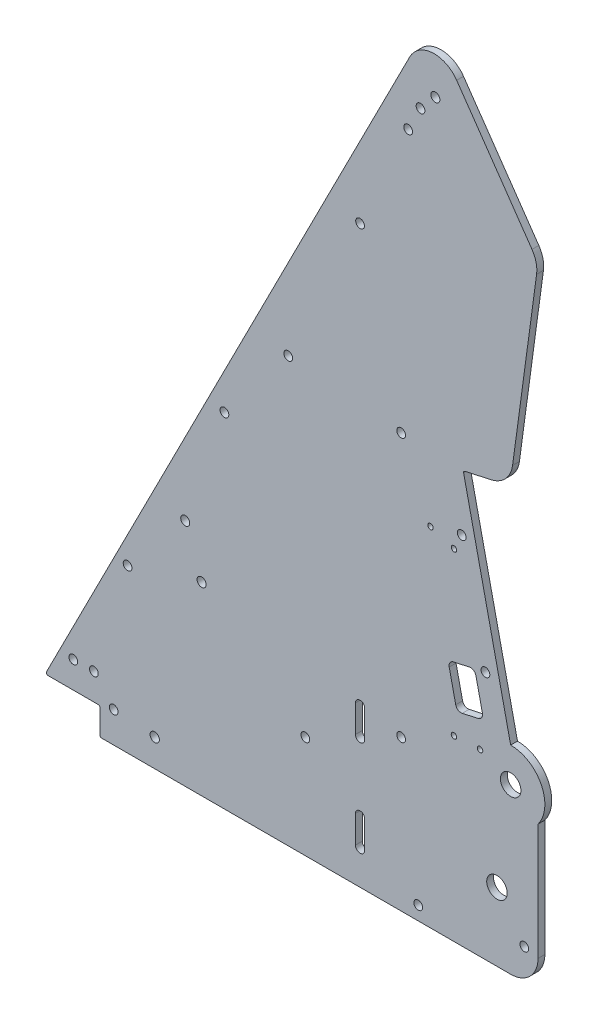
from build123d import *

# Parameters (mm, degrees)
BOSS_EXTRUDE1_DEPTH     = 3.175
SKETCH2_R               = 2.0955
SKETCH2_R_2             = 2.032
SKETCH2_R_3             = 4.7625
CUT_EXTRUDE1_DEPTH      = 421.976111717
SKETCH7_R               = 2.159
CUT_EXTRUDE2_DEPTH      = 421.976111717
CUT_EXTRUDE3_REACH      = 422.976
SKETCH10_R              = 2.032
FILLET1_R               = 12.7
FILLET2_R               = 0.79375
SKETCH12_R              = 2.032
CUT_EXTRUDE5_DEPTH      = 411.989226146
CUT_EXTRUDE6_DEPTH      = 411.989226146
CUT_EXTRUDE6_DEPTH_BACK = 411.989226146
SKETCH13_R              = 1.27
CUT_EXTRUDE7_REACH      = 412.989
SKETCH14_R              = 2.032
SKETCH15_R              = 2.032
CUT_EXTRUDE8_DEPTH      = 411.989226146
FILLET3_R               = 2.54


with BuildPart() as part:
    # Sketch1 → Boss-Extrude1 (new body)
    with BuildSketch(Plane.XY):
        with BuildLine():
            Line((228.6, -12.7), (228.6, 53.975))
            ThreePointArc((228.6, 53.975), (230.099031657, 70.599515829), (215.9, 79.375))
            Line((215.9, 79.375), (193.909735224, 178.566674323))
            Line((193.909735224, 178.566674323), (215.607913982, 183.377044743))
            Line((215.607913982, 183.377044743), (228.6, 279.4))
            Line((228.6, 279.4), (178.754725958, 351.413083686))
            Line((178.754725958, 351.413083686), (0, 0))
            Line((0, 0), (25.4, 0))
            Line((25.4, 0), (25.4, -12.7))
            Line((25.4, -12.7), (228.6, -12.7))
        make_face()
    extrude(amount=BOSS_EXTRUDE1_DEPTH)

    # Sketch2 → Cut-Extrude1 (cut, through all)
    with BuildSketch(Plane.XY.offset(3.175)):
        with Locations((64.943150167, 94.057839899)):
            Circle(SKETCH2_R)
        with Locations((180.975, 322.164313376)):
            Circle(SKETCH2_R)
        with Locations((72.544547852, 73.173171402)):
            Circle(SKETCH2_R)
        with Locations((193.207821773, 152.394364194)):
            Circle(SKETCH2_R_2)
        with Locations((215.9, 63.5)):
            Circle(SKETCH2_R_3)
        with Locations((173.0375, -6.35)):
            Circle(SKETCH2_R_2)
        with Locations((204.202954161, 102.798527032)):
            Circle(SKETCH2_R_2)
        with Locations((209.55, 19.05)):
            Circle(SKETCH2_R_3)
        with Locations((165.1, 179.3875)):
            Circle(SKETCH2_R_2)
    extrude(amount=-CUT_EXTRUDE1_DEPTH, mode=Mode.SUBTRACT)

    # Sketch7 → Cut-Extrude2 (cut, through all)
    with BuildSketch(Plane.XY.offset(3.175)):
        with Locations((50.8, 0)):
            Circle(SKETCH7_R)
        with BuildLine():
            Line((143.891, 3.175), (143.891, 15.875))
            ThreePointArc((143.891, 15.875), (146.05, 18.034), (148.209, 15.875))
            Line((148.209, 15.875), (148.209, 3.175))
            ThreePointArc((148.209, 3.175), (146.05, 1.016), (143.891, 3.175))
        make_face()
        with BuildLine():
            Line((143.891, 47.625), (143.891, 60.325))
            ThreePointArc((143.891, 60.325), (146.05, 62.484), (148.209, 60.325))
            Line((148.209, 60.325), (148.209, 47.625))
            ThreePointArc((148.209, 47.625), (146.05, 45.466), (143.891, 47.625))
        make_face()
    extrude(amount=-CUT_EXTRUDE2_DEPTH, mode=Mode.SUBTRACT)

    # Sketch10 → Cut-Extrude3 (cut, up to next)
    with BuildSketch(Plane.XY.offset(3.175), mode=Mode.PRIVATE) as cut_extrude3_sk1:
        with Locations((165.1, 57.15)):
            Circle(SKETCH10_R)
    cut_extrude3_tool1 = extrude(cut_extrude3_sk1.sketch, amount=-CUT_EXTRUDE3_REACH, mode=Mode.PRIVATE) & part.part
    # Sketch10 → Cut-Extrude3 (cut, up to next)
    with BuildSketch(Plane.XY.offset(3.175), mode=Mode.PRIVATE) as cut_extrude3_sk2:
        with Locations((120.65, 34.925)):
            Circle(SKETCH10_R)
    cut_extrude3_tool2 = extrude(cut_extrude3_sk2.sketch, amount=-CUT_EXTRUDE3_REACH, mode=Mode.PRIVATE) & part.part
    # Sketch10 → Cut-Extrude3 (cut, up to next)
    with BuildSketch(Plane.XY.offset(3.175), mode=Mode.PRIVATE) as cut_extrude3_sk3:
        with Locations((13.046467246, 12.334704411)):
            Circle(SKETCH10_R)
    cut_extrude3_tool3 = extrude(cut_extrude3_sk3.sketch, amount=-CUT_EXTRUDE3_REACH, mode=Mode.PRIVATE) & part.part
    # Sketch10 → Cut-Extrude3 (cut, up to next)
    with BuildSketch(Plane.XY.offset(3.175), mode=Mode.PRIVATE) as cut_extrude3_sk4:
        with Locations((22.571467246, 12.334704411)):
            Circle(SKETCH10_R)
    cut_extrude3_tool4 = extrude(cut_extrude3_sk4.sketch, amount=-CUT_EXTRUDE3_REACH, mode=Mode.PRIVATE) & part.part
    # Sketch10 → Cut-Extrude3 (cut, up to next)
    with BuildSketch(Plane.XY.offset(3.175), mode=Mode.PRIVATE) as cut_extrude3_sk5:
        with Locations((38.211447917, 62.639810909)):
            Circle(SKETCH10_R)
    cut_extrude3_tool5 = extrude(cut_extrude3_sk5.sketch, amount=-CUT_EXTRUDE3_REACH, mode=Mode.PRIVATE) & part.part
    add(cut_extrude3_tool1.solids().sort_by_distance((165.1, 57.15, 3.175))[0], mode=Mode.SUBTRACT)
    add(cut_extrude3_tool2.solids().sort_by_distance((120.65, 34.925, 3.175))[0], mode=Mode.SUBTRACT)
    add(cut_extrude3_tool3.solids().sort_by_distance((13.046467, 12.334704, 3.175))[0], mode=Mode.SUBTRACT)
    add(cut_extrude3_tool4.solids().sort_by_distance((22.571467, 12.334704, 3.175))[0], mode=Mode.SUBTRACT)
    add(cut_extrude3_tool5.solids().sort_by_distance((38.211448, 62.639811, 3.175))[0], mode=Mode.SUBTRACT)

    # Fillet1
    fillet1_edges = [part.edges().sort_by_distance(p)[0] for p in [
        (228.6, -12.7, 1.5875),
        (178.754725958, 351.413083686, 1.5875),
        (215.607913982, 183.377044743, 1.5875),
        (228.6, 279.4, 1.5875),
    ]]
    fillet(fillet1_edges, radius=FILLET1_R)

    # Fillet2
    fillet2_edges = [part.edges().sort_by_distance(p)[0] for p in [
        (25.4, -12.7, 1.5875),
        (25.4, 0, 1.5875),
        (193.909735224, 178.566674323, 1.5875),
        (0, 0, 1.5875),
    ]]
    fillet(fillet2_edges, radius=FILLET2_R)

    # Sketch12 → Cut-Extrude5 (cut, through all)
    with BuildSketch(Plane.XY.offset(3.175)):
        with Locations((31.75, 1.5875)):
            Circle(SKETCH12_R)
        with Locations((222.25, 1.5875)):
            Circle(SKETCH12_R)
    extrude(amount=-CUT_EXTRUDE5_DEPTH, mode=Mode.SUBTRACT)

    # Sketch13 → Cut-Extrude6 (cut, two sides: drawn at the far end of the back side and taken through both)
    with BuildSketch(Plane.XY.offset(3.175).offset(-CUT_EXTRUDE6_DEPTH_BACK)):
        with Locations((189.602197334, 69.980636704)):
            Circle(SKETCH13_R)
        with Locations((201.708862449, 70.509225118)):
            Circle(SKETCH13_R)
        with Locations((178.721644858, 148.532438598)):
            Circle(SKETCH13_R)
        with Locations((189.622629605, 145.09537131)):
            Circle(SKETCH13_R)
        Polygon((186.844411154, 98.950230697), (199.243370445, 101.699013794), (203.36654509, 83.100574858), (190.9675858, 80.351791761), align=None)
    extrude(amount=CUT_EXTRUDE6_DEPTH + CUT_EXTRUDE6_DEPTH_BACK, mode=Mode.SUBTRACT)

    # Sketch14 → Cut-Extrude7 (cut, up to next)
    with BuildSketch(Plane.XY.offset(3.175), mode=Mode.PRIVATE) as cut_extrude7_sk1:
        with Locations((146.05, 254)):
            Circle(SKETCH14_R)
    cut_extrude7_tool1 = extrude(cut_extrude7_sk1.sketch, amount=-CUT_EXTRUDE7_REACH, mode=Mode.PRIVATE) & part.part
    # Sketch14 → Cut-Extrude7 (cut, up to next)
    with BuildSketch(Plane.XY.offset(3.175), mode=Mode.PRIVATE) as cut_extrude7_sk2:
        with Locations((112.7125, 184.15)):
            Circle(SKETCH14_R)
    cut_extrude7_tool2 = extrude(cut_extrude7_sk2.sketch, amount=-CUT_EXTRUDE7_REACH, mode=Mode.PRIVATE) & part.part
    add(cut_extrude7_tool1.solids().sort_by_distance((146.05, 254, 3.175))[0], mode=Mode.SUBTRACT)
    add(cut_extrude7_tool2.solids().sort_by_distance((112.7125, 184.15, 3.175))[0], mode=Mode.SUBTRACT)

    # Sketch15 → Cut-Extrude8 (cut, through all)
    with BuildSketch(Plane.XY.offset(3.175)):
        with Locations((83.136819993, 146.631489078)):
            Circle(SKETCH15_R)
        with Locations((174.09945174, 314.249971175)):
            Circle(SKETCH15_R)
        with Locations((168.341424664, 302.930292549)):
            Circle(SKETCH15_R)
    extrude(amount=-CUT_EXTRUDE8_DEPTH, mode=Mode.SUBTRACT)

    # Fillet3
    fillet3_edges = [part.edges().sort_by_distance(p)[0] for p in [
        (199.243370445, 101.699013794, 1.5875),
        (186.844411154, 98.950230697, 1.5875),
        (190.9675858, 80.351791761, 1.5875),
        (203.36654509, 83.100574858, 1.5875),
    ]]
    fillet(fillet3_edges, radius=FILLET3_R)


solid = part.part
